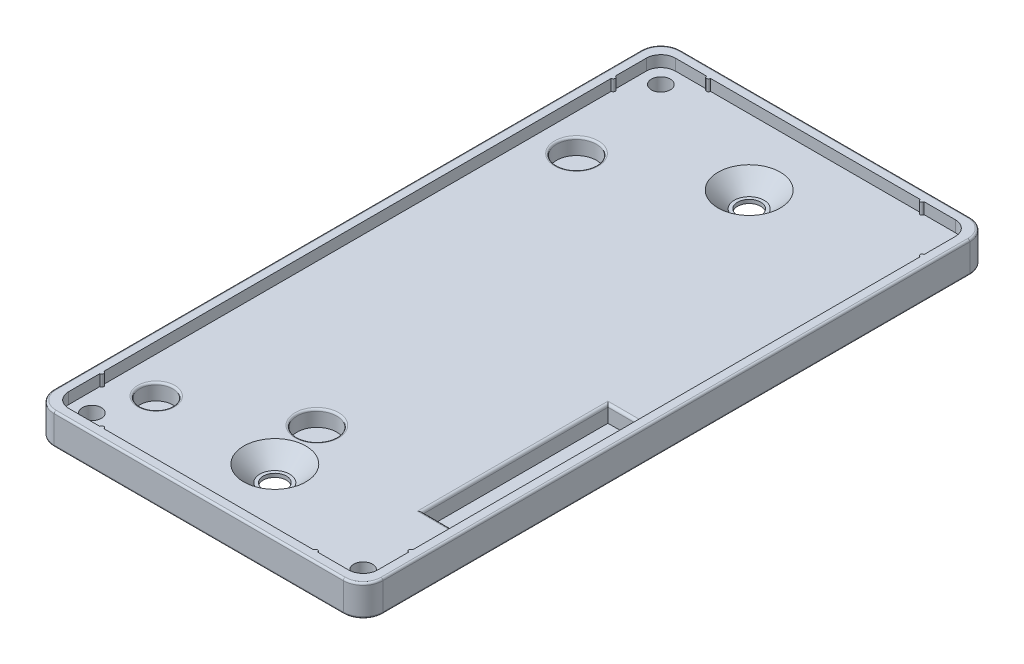
from build123d import *

# Parameters (mm, degrees)
BOSS_EXTRUDE1_DEPTH         = 1.7
BOSS_EXTRUDE2_START         = 3
BOSS_EXTRUDE2_DEPTH         = 3
SKETCH8_W                   = 4.8
SKETCH8_H                   = 28
CUT_EXTRUDE1_DEPTH          = 2.5
FILLET4_R                   = 0.2
FILLET5_R                   = 0.4
SKETCH9_W                   = 86.507832479
SKETCH9_H                   = 115.776512498
CUT_EXTRUDE2_DEPTH          = 10
SKETCH10_R                  = 1.425
CUT_EXTRUDE3_DEPTH          = 54.558799464
SKETCH11_R                  = 1.75
CUT_EXTRUDE4_DEPTH          = 10
ADVANCEDHOLE2_OUTLINE_R     = 2.25
ADVANCEDHOLE2_OUTLINE_R_2   = 1.75
ADVANCEDHOLE2_DEPTH         = 2.45
ADVANCEDHOLE2_DRAFT         = -45
ADVANCEDHOLE2_2_OUTLINE_R   = 2.25
ADVANCEDHOLE2_2_OUTLINE_R_2 = 1.75
ADVANCEDHOLE2_2_DEPTH       = 2.45
ADVANCEDHOLE2_2_DRAFT       = -45
SKETCH15_R                  = 0.3
BOSS_EXTRUDE3_DEPTH         = 1.7
FILLET6_R                   = 0.3
SKETCH16_R                  = 3
SKETCH16_R_2                = 2.5
CUT_EXTRUDE5_DEPTH          = 2.4
FILLET7_R                   = 0.3


# Read off the part's stored shape, not the designer's step: AdvancedHole2
with BuildPart() as part:
    # Sketch1 → Boss-Extrude1 (new body)
    with BuildSketch(Plane(origin=(0, 0, 0), x_dir=(1, 0, 0), z_dir=(0, 1, 0))):
        with BuildLine():
            Line((-21.85, 48.35), (21.85, 48.35))
            ThreePointArc((21.85, 48.35), (24.678427125, 47.178427125), (25.85, 44.35))
            Line((25.85, 44.35), (25.85, -44.35))
            ThreePointArc((25.85, -44.35), (24.678427125, -47.178427125), (21.85, -48.35))
            Line((21.85, -48.35), (-21.85, -48.35))
            ThreePointArc((-21.85, -48.35), (-24.678427125, -47.178427125), (-25.85, -44.35))
            Line((-25.85, -44.35), (-25.85, 44.35))
            ThreePointArc((-25.85, 44.35), (-24.678427125, 47.178427125), (-21.85, 48.35))
        make_face()
        with BuildLine():
            Line((-21.15, 45.85), (21.15, 45.85))
            ThreePointArc((21.15, 45.85), (22.705634919, 45.205634919), (23.35, 43.65))
            Line((23.35, 43.65), (23.35, -43.65))
            ThreePointArc((23.35, -43.65), (22.705634919, -45.205634919), (21.15, -45.85))
            Line((21.15, -45.85), (-21.15, -45.85))
            ThreePointArc((-21.15, -45.85), (-22.705634919, -45.205634919), (-23.35, -43.65))
            Line((-23.35, -43.65), (-23.35, 43.65))
            ThreePointArc((-23.35, 43.65), (-22.705634919, 45.205634919), (-21.15, 45.85))
        make_face(mode=Mode.SUBTRACT)
    extrude(amount=BOSS_EXTRUDE1_DEPTH)

    # Sketch2 → Boss-Extrude2 (add)
    with BuildSketch(Plane.XZ.offset(BOSS_EXTRUDE2_START)):
        with BuildLine():
            Line((-25.85, 44.35), (-25.85, -44.35))
            ThreePointArc((-25.85, -44.35), (-24.678427125, -47.178427125), (-21.85, -48.35))
            Line((-21.85, -48.35), (21.85, -48.35))
            ThreePointArc((21.85, -48.35), (24.678427125, -47.178427125), (25.85, -44.35))
            Line((25.85, -44.35), (25.85, 44.35))
            ThreePointArc((25.85, 44.35), (24.678427125, 47.178427125), (21.85, 48.35))
            Line((21.85, 48.35), (-21.85, 48.35))
            ThreePointArc((-21.85, 48.35), (-24.678427125, 47.178427125), (-25.85, 44.35))
        make_face()
    extrude(amount=-BOSS_EXTRUDE2_DEPTH)

    # Sketch8 → Cut-Extrude1 (cut)
    with BuildSketch(Plane(origin=(0, 0, 0), x_dir=(1, 0, 0), z_dir=(0, 1, 0))):
        with Locations((19.75, -16.85)):
            Rectangle(SKETCH8_W, SKETCH8_H)
    extrude(amount=-CUT_EXTRUDE1_DEPTH, mode=Mode.SUBTRACT)

    # Fillet4
    fillet4_edges = [part.edges().sort_by_distance(p)[0] for p in [
        (-24.678427125, -3, 47.178427125),
        (-25.85, -3, 0),
        (-24.678427125, -3, -47.178427125),
        (0, -3, -48.35),
        (24.678427125, -3, -47.178427125),
        (25.85, -3, 0),
        (24.678427125, -3, 47.178427125),
        (0, -3, 48.35),
    ]]
    fillet(fillet4_edges, radius=FILLET4_R)

    # Fillet5
    fillet5_edges = [part.edges().sort_by_distance(p)[0] for p in [
        (22.15, 0, 16.85),
        (19.75, 0, 2.85),
        (17.35, 0, 16.85),
        (19.75, 0, 30.85),
    ]]
    fillet(fillet5_edges, radius=FILLET5_R)

    # Sketch9 → Cut-Extrude2 (cut)
    with BuildSketch(Plane(origin=(0, 1.7, 0), x_dir=(1, 0, 0), z_dir=(0, 1, 0))):
        with Locations((1.136314031, 0.63119656)):
            Rectangle(SKETCH9_W, SKETCH9_H)
        with BuildLine():
            Line((-21.85, -47.35), (21.85, -47.35))
            ThreePointArc((21.85, -47.35), (23.971320344, -46.471320344), (24.85, -44.35))
            Line((24.85, -44.35), (24.85, 44.35))
            ThreePointArc((24.85, 44.35), (23.971320344, 46.471320344), (21.85, 47.35))
            Line((21.85, 47.35), (-21.85, 47.35))
            ThreePointArc((-21.85, 47.35), (-23.971320344, 46.471320344), (-24.85, 44.35))
            Line((-24.85, 44.35), (-24.85, -44.35))
            ThreePointArc((-24.85, -44.35), (-23.971320344, -46.471320344), (-21.85, -47.35))
        make_face(mode=Mode.SUBTRACT)
    extrude(amount=-CUT_EXTRUDE2_DEPTH, mode=Mode.SUBTRACT)

    # Sketch10 → Cut-Extrude3 (cut, through all)
    with BuildSketch(Plane(origin=(0, 0, 0), x_dir=(1, 0, 0), z_dir=(0, 1, 0))):
        with Locations(Location((-20.5, 43, 0), (0, 0, 270))):
            Circle(SKETCH10_R)
        with Locations(Location((-20.5, -43, 0), (0, 0, 270))):
            Circle(SKETCH10_R)
        with Locations(Location((20.5, -43, 0), (0, 0, 270))):
            Circle(SKETCH10_R)
    extrude(amount=-CUT_EXTRUDE3_DEPTH, mode=Mode.SUBTRACT)

    # Sketch11 → Cut-Extrude4 (cut)
    with BuildSketch(Plane(origin=(0, 0, 0), x_dir=(1, 0, 0), z_dir=(0, 1, 0))):
        with Locations(Location((0, 35.85, 0), (0, 0, 270))):
            Circle(SKETCH11_R)
        with Locations(Location((0, -35.85, 0), (0, 0, 270))):
            Circle(SKETCH11_R)
    extrude(amount=-CUT_EXTRUDE4_DEPTH, mode=Mode.SUBTRACT)


with BuildPart() as advancedhole2_tool:
    # AdvancedHole2 outline → AdvancedHole2 (with draft: the straight prism first)
    with BuildSketch(Plane(origin=(0, -2.45, 0), x_dir=(1, 0, 0), z_dir=(0, 1, 0))):
        with Locations((0, -35.85)):
            Circle(ADVANCEDHOLE2_OUTLINE_R)
        with Locations((0, -35.85)):
            Circle(ADVANCEDHOLE2_OUTLINE_R_2, mode=Mode.SUBTRACT)
    extrude(amount=ADVANCEDHOLE2_DEPTH)
    # AdvancedHole2: the draft: its side faces are tilted about the plane it starts from
    advancedhole2_sides = [advancedhole2_tool.faces().sort_by_distance(p)[0] for p in [
        (-2.25, -1.225, 35.85),
        (-1.75, -1.225, 35.85),
    ]]
    draft(advancedhole2_sides, Plane(origin=(0, -2.45, 0), x_dir=(1, 0, 0), z_dir=(0, 1, 0)), ADVANCEDHOLE2_DRAFT)


with BuildPart() as part_1:
    add(part.part)

    # AdvancedHole2: cut by advancedhole2_tool
    add(advancedhole2_tool.part, mode=Mode.SUBTRACT)


with BuildPart() as advancedhole2_2_tool:
    # AdvancedHole2 2 outline → AdvancedHole2 2 (with draft: the straight prism first)
    with BuildSketch(Plane(origin=(0, -2.45, 0), x_dir=(1, 0, 0), z_dir=(0, 1, 0))):
        with Locations((0, 35.85)):
            Circle(ADVANCEDHOLE2_2_OUTLINE_R)
        with Locations((0, 35.85)):
            Circle(ADVANCEDHOLE2_2_OUTLINE_R_2, mode=Mode.SUBTRACT)
    extrude(amount=ADVANCEDHOLE2_2_DEPTH)
    # AdvancedHole2 2: the draft: its side faces are tilted about the plane it starts from
    advancedhole2_2_sides = [advancedhole2_2_tool.faces().sort_by_distance(p)[0] for p in [
        (-2.25, -1.225, -35.85),
        (-1.75, -1.225, -35.85),
    ]]
    draft(advancedhole2_2_sides, Plane(origin=(0, -2.45, 0), x_dir=(1, 0, 0), z_dir=(0, 1, 0)), ADVANCEDHOLE2_2_DRAFT)


with BuildPart() as part_2:
    add(part_1.part)

    # AdvancedHole2 2: cut by advancedhole2_2_tool
    add(advancedhole2_2_tool.part, mode=Mode.SUBTRACT)

    # Sketch15 → Boss-Extrude3 (add)
    with BuildSketch(Plane(origin=(0, 1.7, 0), x_dir=(1, 0, 0), z_dir=(0, 1, 0))):
        with Locations((-23.35, -38.65)):
            Circle(SKETCH15_R)
        with Locations((-16.15, -45.85)):
            Circle(SKETCH15_R)
        with Locations((16.15, -45.85)):
            Circle(SKETCH15_R)
        with Locations((23.35, -38.65)):
            Circle(SKETCH15_R)
        with Locations((-23.35, 38.65)):
            Circle(SKETCH15_R)
        with Locations((-16.15, 45.85)):
            Circle(SKETCH15_R)
        with Locations((16.15, 45.85)):
            Circle(SKETCH15_R)
        with Locations((23.35, 38.65)):
            Circle(SKETCH15_R)
    extrude(amount=-BOSS_EXTRUDE3_DEPTH)

    # Fillet6
    fillet6_edges = [part_2.edges().sort_by_distance(p)[0] for p in [
        (0, -3, 47.35),
        (23.971320344, -3, 46.471320344),
        (24.85, -3, 0),
        (23.971320344, -3, -46.471320344),
        (0, -3, -47.35),
        (-23.971320344, -3, -46.471320344),
        (-24.85, -3, 0),
        (-23.971320344, -3, 46.471320344),
        (-23.971320344, 1.7, 46.471320344),
        (-24.85, 1.7, 0),
        (-23.971320344, 1.7, -46.471320344),
        (0, 1.7, -47.35),
        (23.971320344, 1.7, -46.471320344),
        (24.85, 1.7, 0),
        (23.971320344, 1.7, 46.471320344),
        (0, 1.7, 47.35),
    ]]
    fillet(fillet6_edges, radius=FILLET6_R)

    # Sketch16 → Cut-Extrude5 (cut)
    with BuildSketch(Plane(origin=(0, 0, 0), x_dir=(1, 0, 0), z_dir=(0, 1, 0))):
        with Locations(Location((-17.85, 27.6, 0), (0, 0, 270))):
            Circle(SKETCH16_R)
        with Locations(Location((-17.85, -35.9277, 0), (0, 0, 270))):
            Circle(SKETCH16_R_2)
        with Locations(Location((-1.89, -27.6, 0), (0, 0, 270))):
            Circle(SKETCH16_R)
    extrude(amount=-CUT_EXTRUDE5_DEPTH, mode=Mode.SUBTRACT)

    # Fillet7
    fillet7_edges = [part_2.edges().sort_by_distance(p)[0] for p in [
        (-17.85, 0, -30.6),
        (-17.85, 0, 33.4277),
        (-1.89, 0, 24.6),
    ]]
    fillet(fillet7_edges, radius=FILLET7_R)


solid = part_2.part
